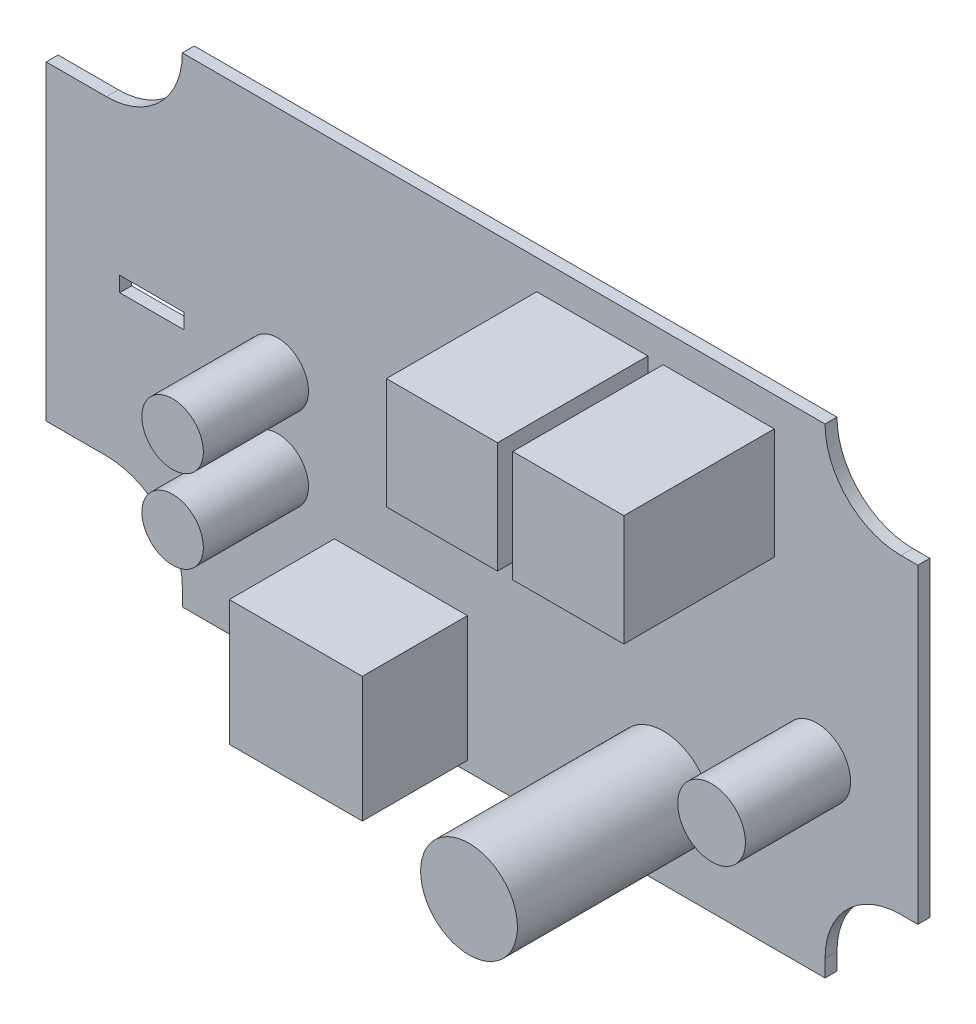
from build123d import *

# Parameters (mm, degrees)
SKETCH1_W           = 8.5
SKETCH1_H           = 2
BOSS_EXTRUDE1_DEPTH = 1.5748
SKETCH2_W           = 14.65
SKETCH2_H           = 14.65
BOSS_EXTRUDE2_DEPTH = 19.82
SKETCH3_R           = 6.38
BOSS_EXTRUDE3_DEPTH = 25.62
SKETCH4_R           = 4.05
SKETCH4_R_2         = 4.45846
SKETCH4_W           = 17.528842204
SKETCH4_H           = 16.527194078
BOSS_EXTRUDE4_DEPTH = 13.86


with BuildPart() as part:
    # Sketch1 → Boss-Extrude1 (new body)
    with BuildSketch(Plane.XY):
        with BuildLine():
            Line((42.354093023, -30.703264053), (42.354093023, -32.943264053))
            Line((42.354093023, -32.943264053), (-42.354093023, -32.943264053))
            Line((-42.354093023, -32.943264053), (-42.354093023, -30.703264053))
            ThreePointArc((-42.354093023, -30.703264053), (-45.283025211, -23.632196241), (-52.354093023, -20.703264053))
            Line((-52.354093023, -20.703264053), (-60.301272865, -20.703264053))
            Line((-60.301272865, -20.703264053), (-60.301272865, 20.296735947))
            Line((-60.301272865, 20.296735947), (-52.354093023, 20.296735947))
            ThreePointArc((-52.354093023, 20.296735947), (-45.283025211, 23.225668135), (-42.354093023, 30.296735947))
            Line((-42.354093023, 30.296735947), (42.354093023, 30.296735947))
            ThreePointArc((42.354093023, 30.296735947), (45.283025211, 23.225668135), (52.354093023, 20.296735947))
            Line((52.354093023, 20.296735947), (54.593335979, 20.296735947))
            Line((54.593335979, 20.296735947), (54.593335979, -20.703264053))
            Line((54.593335979, -20.703264053), (52.354093023, -20.703264053))
            ThreePointArc((52.354093023, -20.703264053), (45.283025211, -23.632196241), (42.354093023, -30.703264053))
        make_face()
        with Locations((-46.358811397, -0.203264053)):
            Rectangle(SKETCH1_W, SKETCH1_H, mode=Mode.SUBTRACT)
    extrude(amount=BOSS_EXTRUDE1_DEPTH)

    # Sketch2 → Boss-Extrude2 (add)
    with BuildSketch(Plane.XY.offset(1.5748)):
        with Locations((11.686894588, 19.066351865)):
            Rectangle(SKETCH2_W, SKETCH2_H)
        with Locations((28.336894588, 19.066351865)):
            Rectangle(SKETCH2_W, SKETCH2_H)
    extrude(amount=BOSS_EXTRUDE2_DEPTH)

    # Sketch3 → Boss-Extrude3 (add)
    with BuildSketch(Plane.XY.offset(1.5748)):
        with Locations((21.050882576, -21.779136192)):
            Circle(SKETCH3_R)
    extrude(amount=BOSS_EXTRUDE3_DEPTH)

    # Sketch4 → Boss-Extrude4 (add)
    with BuildSketch(Plane.XY.offset(1.5748)):
        with Locations((-29.775377187, 0)):
            Circle(SKETCH4_R)
        with Locations((-29.775377187, -10.91000664)):
            Circle(SKETCH4_R)
        with Locations((41.26131402, -8.841126254)):
            Circle(SKETCH4_R_2)
        with Locations((-13.538274313, -23.407391016)):
            Rectangle(SKETCH4_W, SKETCH4_H)
    extrude(amount=BOSS_EXTRUDE4_DEPTH)


solid = part.part
